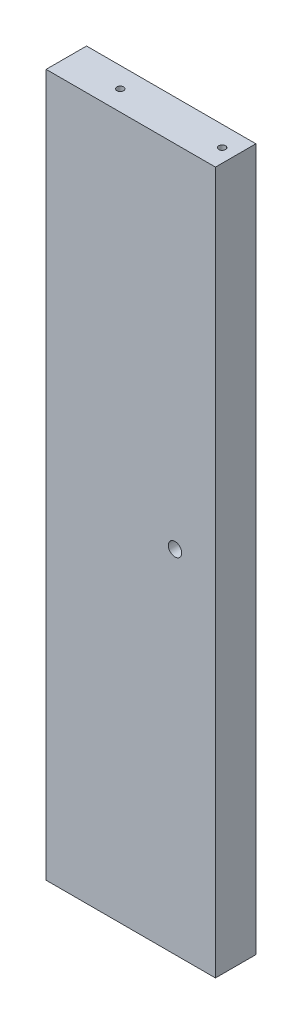
from build123d import *

# Parameters (mm, degrees)
SKETCH1_W                   = 79.793650928
SKETCH1_H                   = 330.949999988
BOSS_EXTRUDE1_DEPTH         = 19.05
HOLE3_D                     = 3.175
HOLE3_DEPTH                 = 38.1
HOLE3_CSINK_D               = 10.16
HOLE3_CSINK_ANGLE           = 82
HOLE3_TIP                   = 0.953866233
F_1_4_0_25_DIAMETER_HOLE1_D = 6.35
HOLE5_D                     = 3.175
HOLE5_DEPTH                 = 38.1
HOLE5_CSINK_D               = 10.16
HOLE5_CSINK_ANGLE           = 82
HOLE5_TIP                   = 0.953866233


with BuildPart() as part:
    # Sketch1 → Boss-Extrude1 (new body)
    with BuildSketch(Plane.XY):
        with Locations((249.249792645, -72.024999997)):
            Rectangle(SKETCH1_W, SKETCH1_H)
    extrude(amount=BOSS_EXTRUDE1_DEPTH)

    # Hole3
    with Locations(Plane(origin=(-181.039434513, 112.499999997, 386.262770337), x_dir=(0.9271838545667855, -1.3196841813264566e-15, -0.37460659341591657), z_dir=(0, 1, 0))):
        with Locations((47.413288654, 127.596711745), (39.315467427, 37.945520226), (403.288916316, 71.764018496), (399.091743996, 25.297013484), (513.561319184, 161.164706775), (558.106616554, 143.167238399), (571.189751829, 175.54913452), (654.969392627, 382.911022042), (526.644454459, 193.546602895), (610.424095257, 400.908490418)):
            CounterSinkHole(HOLE3_D / 2, HOLE3_CSINK_D / 2, depth=HOLE3_DEPTH, counter_sink_angle=HOLE3_CSINK_ANGLE)
            with Locations((0, 0, -(HOLE3_DEPTH + HOLE3_TIP / 2))):  # 118° drill point
                Cone(0, HOLE3_D / 2, HOLE3_TIP, mode=Mode.SUBTRACT)

    # 1/4 (0.25) Diameter Hole1 (through all)
    with Locations(Plane(origin=(0, 0, 0), x_dir=(-1, 0, 0), z_dir=(0, 0, -1))):
        with Locations((-270.096618017, -72.024999997)):
            Hole(F_1_4_0_25_DIAMETER_HOLE1_D / 2)

    # Hole5
    with Locations(Plane(origin=(-181.039434513, 112.499999997, 609.909770337), x_dir=(0.9271838545667913, -6.190403823971236e-15, -0.3746065934159023), z_dir=(0, 1, 0))):
        with Locations((47.413288654, 127.596711745), (39.315467427, 37.945520226), (403.288916316, 71.764018496), (399.091743996, 25.297013484), (513.561319184, 161.164706775), (558.106616554, 143.167238399), (571.189751829, 175.54913452), (654.969392627, 382.911022042), (526.644454459, 193.546602895), (610.424095257, 400.908490418)):
            CounterSinkHole(HOLE5_D / 2, HOLE5_CSINK_D / 2, depth=HOLE5_DEPTH, counter_sink_angle=HOLE5_CSINK_ANGLE)
            with Locations((0, 0, -(HOLE5_DEPTH + HOLE5_TIP / 2))):  # 118° drill point
                Cone(0, HOLE5_D / 2, HOLE5_TIP, mode=Mode.SUBTRACT)


solid = part.part
